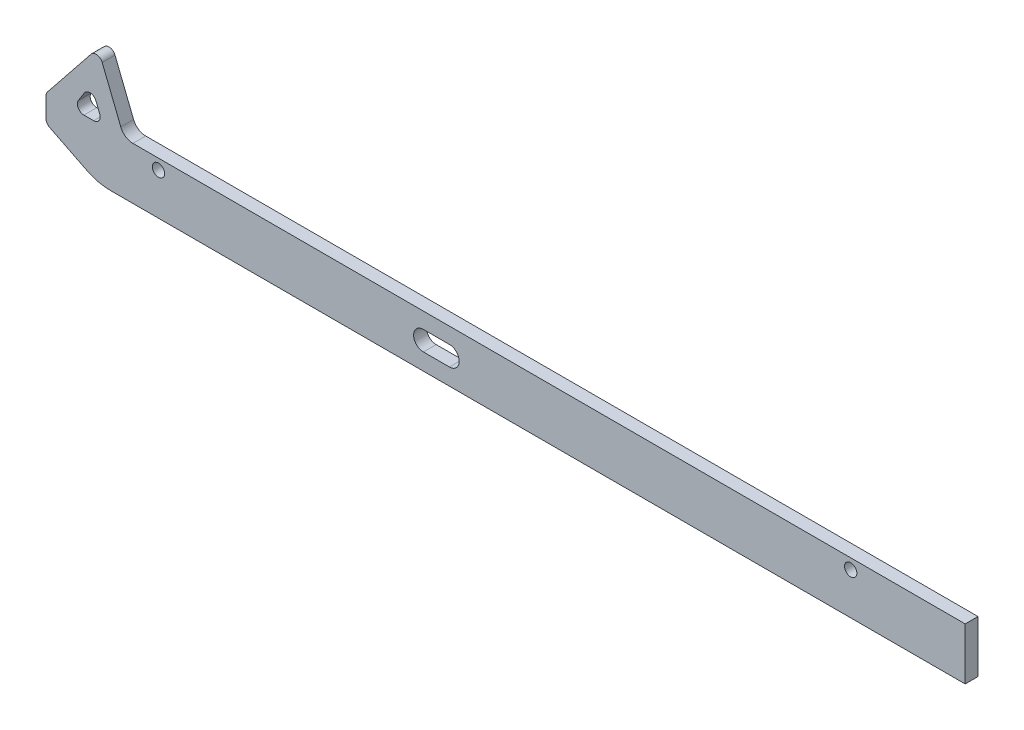
from build123d import *

# Parameters (mm, degrees)
BOSS_EXTRUDE1_DEPTH = 3.1242
FILLET4_R           = 12.7
FILLET8_R           = 1.5875
FILLET9_R           = 3.175
CUT_EXTRUDE1_DEPTH  = 116.691473387
SKETCH3_R           = 1.5
CUT_EXTRUDE2_DEPTH  = 116.691473387


with BuildPart() as part:
    # Sketch1 → Boss-Extrude1 (new body)
    with BuildSketch(Plane.XY):
        Polygon((113.799832915, -6.443650697), (-97.791946085, -6.443650697), (-110.491946085, -0.093650697), (-110.491946085, 6.256349303), (-97.791946085, 22.131349303), (-91.441946085, 6.256349303), (113.799832915, 6.256349303), align=None)
        Polygon((-104.141946085, 6.256349303), (-99.460780317, 13.603434884), (-96.521946085, 6.256349303), align=None, mode=Mode.SUBTRACT)
    extrude(amount=BOSS_EXTRUDE1_DEPTH)

    # Fillet4
    fillet4_edges = [part.edges().sort_by_distance(p)[0] for p in [
        (-97.791946085, -6.443650697, 1.5621),
    ]]
    fillet(fillet4_edges, radius=FILLET4_R)

    # Fillet8
    fillet8_edges = [part.edges().sort_by_distance(p)[0] for p in [
        (-110.491946085, -0.093650697, 1.5621),
        (-110.491946085, 6.256349303, 1.5621),
        (-97.791946085, 22.131349303, 1.5621),
        (-99.460780317, 13.603434884, 1.5621),
        (-104.141946085, 6.256349303, 1.5621),
        (-96.521946085, 6.256349303, 1.5621),
    ]]
    fillet(fillet8_edges, radius=FILLET8_R)

    # Fillet9
    fillet9_edges = [part.edges().sort_by_distance(p)[0] for p in [
        (-91.441946085, 6.256349303, 1.5621),
    ]]
    fillet(fillet9_edges, radius=FILLET9_R)

    # Sketch2 → Cut-Extrude1 (cut, through all)
    with BuildSketch(Plane.XY.offset(3.1242)):
        with BuildLine():
            Line((-18.407167085, 2.38125), (-12.057167085, 2.38125))
            ThreePointArc((-12.057167085, 2.38125), (-9.675917085, 0), (-12.057167085, -2.38125))
            Line((-12.057167085, -2.38125), (-18.407167085, -2.38125))
            ThreePointArc((-18.407167085, -2.38125), (-20.788417085, 0), (-18.407167085, 2.38125))
        make_face()
    extrude(amount=-CUT_EXTRUDE1_DEPTH, mode=Mode.SUBTRACT)

    # Sketch3 → Cut-Extrude2 (cut, through all)
    with BuildSketch(Plane.XY.offset(3.1242)):
        with Locations((85.859832915, 3.716349303)):
            Circle(SKETCH3_R)
        with Locations((-83.050167085, 3.716349303)):
            Circle(SKETCH3_R)
    extrude(amount=-CUT_EXTRUDE2_DEPTH, mode=Mode.SUBTRACT)


solid = part.part
